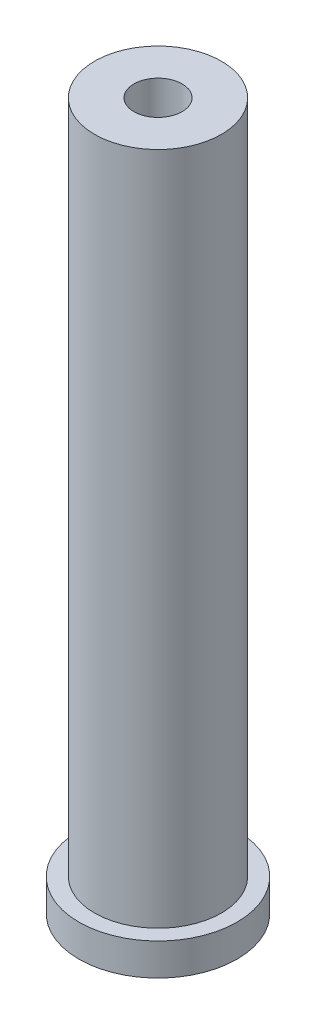
from build123d import *

# Parameters (mm, degrees)
SKIZZE1_R                       = 4.925
AUFSATZ_LINEAR_AUSTRAGEN1_DEPTH = 2
SKIZZE2_R                       = 3.95
AUFSATZ_LINEAR_AUSTRAGEN2_DEPTH = 42
SKIZZE3_R                       = 1.5
SCHNITT_LINEAR_AUSTRAGEN1_DEPTH = 15


with BuildPart() as part:
    # Skizze1 → Aufsatz-Linear austragen1 (new body)
    with BuildSketch(Plane(origin=(0, 0, 0), x_dir=(1, 0, 0), z_dir=(0, 1, 0))):
        Circle(SKIZZE1_R)
    extrude(amount=AUFSATZ_LINEAR_AUSTRAGEN1_DEPTH)

    # Skizze2 → Aufsatz-Linear austragen2 (add)
    with BuildSketch(Plane(origin=(0, 2, 0), x_dir=(1, 0, 0), z_dir=(0, 1, 0))):
        Circle(SKIZZE2_R)
    extrude(amount=AUFSATZ_LINEAR_AUSTRAGEN2_DEPTH)

    # Skizze3 → Schnitt-Linear austragen1 (cut)
    with BuildSketch(Plane(origin=(0, 44, 0), x_dir=(1, 0, 0), z_dir=(0, 1, 0))):
        Circle(SKIZZE3_R)
    extrude(amount=-SCHNITT_LINEAR_AUSTRAGEN1_DEPTH, mode=Mode.SUBTRACT)


solid = part.part
